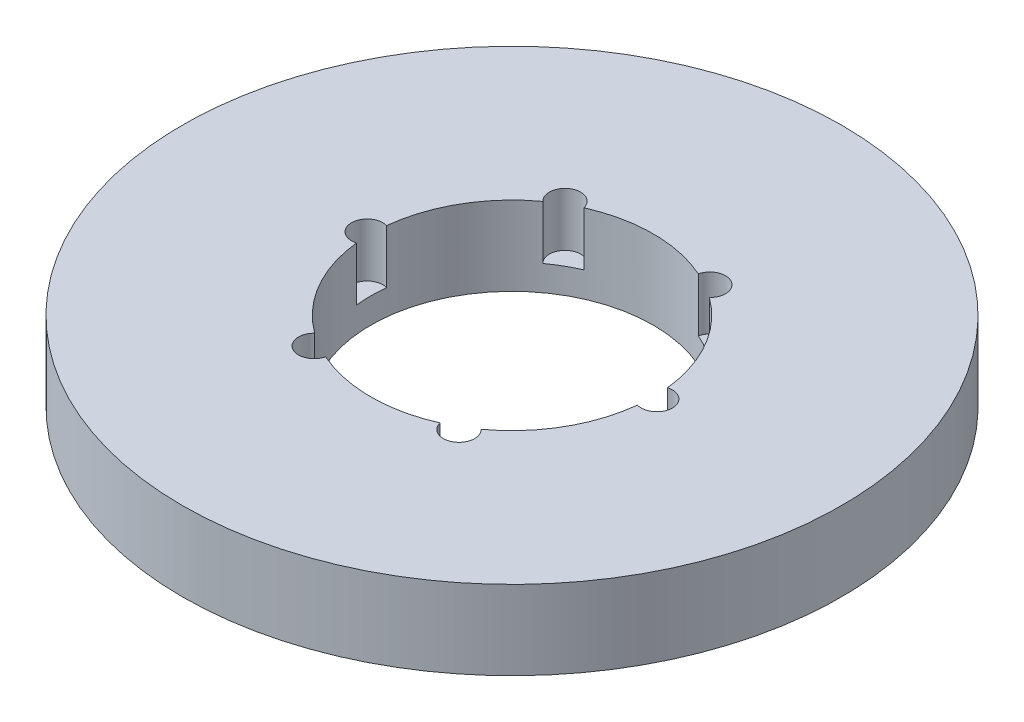
from build123d import *

# Parameters (mm, degrees)
SKETCH1_R           = 87.5
BOSS_EXTRUDE1_DEPTH = 21
SKETCH2_R           = 37.5
CUT_EXTRUDE1_DEPTH  = 126.512947539
SKETCH3_R           = 4.154518723
CUT_EXTRUDE2_DEPTH  = 14.268463859
CIRPATTERN1_COUNT   = 6


with BuildPart() as part:
    # Sketch1 → Boss-Extrude1 (new body)
    with BuildSketch(Plane(origin=(0, 0, 0), x_dir=(1, 0, 0), z_dir=(0, 1, 0))):
        Circle(SKETCH1_R)
    extrude(amount=BOSS_EXTRUDE1_DEPTH)

    # Sketch2 → Cut-Extrude1 (cut, through all)
    with BuildSketch(Plane(origin=(0, 0, 0), x_dir=(1, 0, 0), z_dir=(0, 1, 0))):
        Circle(SKETCH2_R)
    extrude(amount=CUT_EXTRUDE1_DEPTH, mode=Mode.SUBTRACT)

    # Sketch3 → Cut-Extrude2 (cut)
    with BuildSketch(Plane(origin=(0, 21, 0), x_dir=(1, 0, 0), z_dir=(0, 1, 0))):
        with Locations((-38.453678789, 0)):
            Circle(SKETCH3_R)
    cut_extrude2 = extrude(amount=-CUT_EXTRUDE2_DEPTH, mode=Mode.SUBTRACT)

    # CirPattern1: Cut-Extrude2 ×6 about axis
    cirpattern1_axis = Axis((0, 0, 0), (0, 1, 0))
    for i in range(1, CIRPATTERN1_COUNT):
        add(cut_extrude2.rotate(cirpattern1_axis, i * 360 / CIRPATTERN1_COUNT), mode=Mode.SUBTRACT)


solid = part.part
